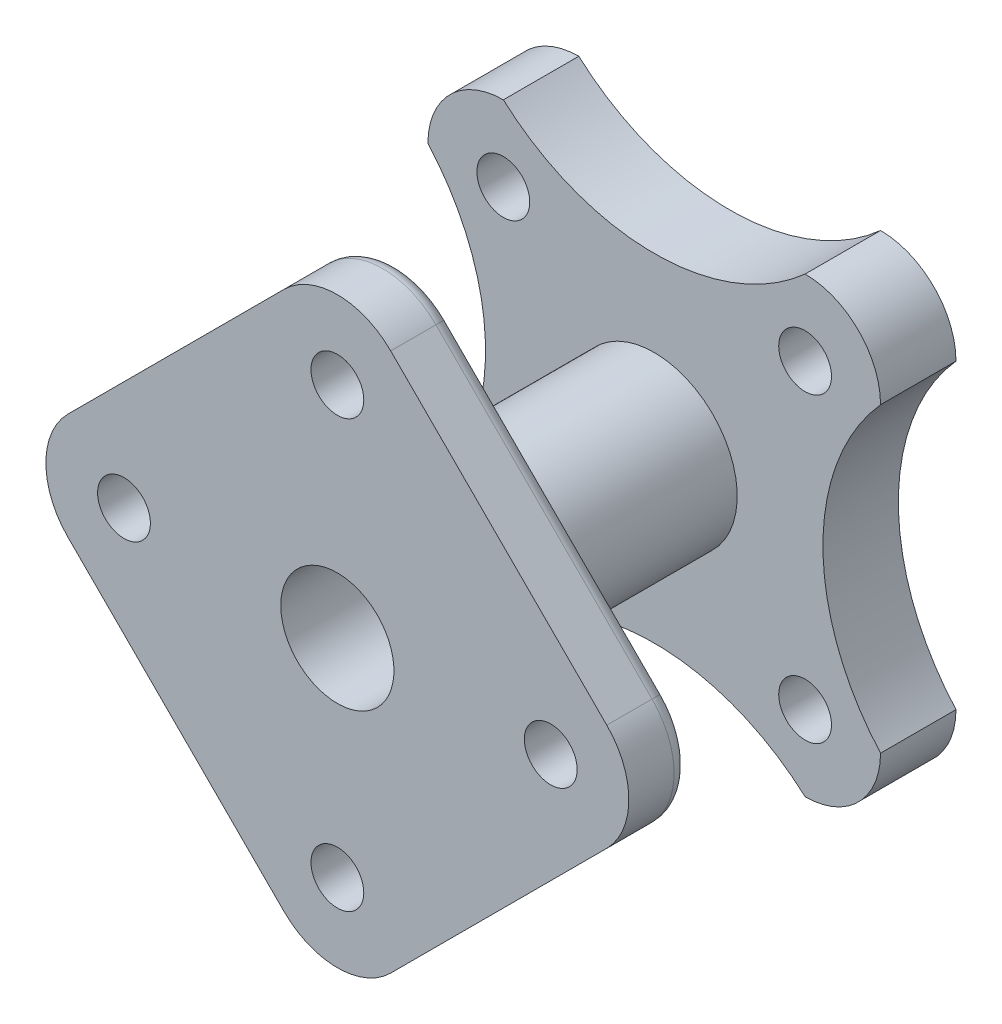
from build123d import *

# Parameters (mm, degrees)
SKETCH1_R           = 4.445
BOSS_EXTRUDE1_DEPTH = 10.16
FILLET1_R           = 12.7
SKETCH2_R           = 13.97
BOSS_EXTRUDE2_DEPTH = 43.18
SKETCH4_R           = 4.445
BOSS_EXTRUDE3_DEPTH = 12.7
SKETCH5_R           = 9.525
CUT_EXTRUDE2_DEPTH  = 109.223551539
SKETCH6_R           = 19.05
CUT_EXTRUDE3_DEPTH  = 2.54
CHAMFER1_SIZE       = 2.54
FILLET2_R           = 2.54


with BuildPart() as part:
    # Sketch1 → Boss-Extrude1 (new body)
    with BuildSketch(Plane.XY):
        Polygon((10.696130127, -43.269340837), (-25.224894357, -7.348316353), (-34.430434771, 1.857224061), (-25.224894357, 11.062764475), (10.696130127, 46.98378896), (19.901670541, 56.189329374), (29.107210955, 46.98378896), (65.02823544, 11.062764475), (74.233775854, 1.857224061), (65.02823544, -7.348316353), (29.107210955, -43.269340837), (19.901670541, -52.474881251), align=None)
        with Locations((-16.019353943, 1.857224061)):
            Circle(SKETCH1_R, mode=Mode.SUBTRACT)
        with Locations((19.901670541, 37.778248545)):
            Circle(SKETCH1_R, mode=Mode.SUBTRACT)
        with Locations((19.901670541, -34.063800423)):
            Circle(SKETCH1_R, mode=Mode.SUBTRACT)
        with Locations((55.822695025, 1.857224061)):
            Circle(SKETCH1_R, mode=Mode.SUBTRACT)
    extrude(amount=BOSS_EXTRUDE1_DEPTH)

    # Fillet1
    fillet1_edges = [part.edges().sort_by_distance(p)[0] for p in [
        (-34.430434771, 1.857224061, 5.08),
        (19.901670541, 56.189329374, 5.08),
        (74.233775854, 1.857224061, 5.08),
        (19.901670541, -52.474881251, 5.08),
    ]]
    fillet(fillet1_edges, radius=FILLET1_R)

    # Sketch2 → Boss-Extrude2 (add)
    with BuildSketch(Plane.XY):
        with Locations((19.901670541, 1.857224061)):
            Circle(SKETCH2_R)
    extrude(amount=-BOSS_EXTRUDE2_DEPTH)

    # Sketch4 → Boss-Extrude3 (add)
    with BuildSketch(Plane(origin=(0, 0, -43.18), x_dir=(-1, 0, 0), z_dir=(0, 0, -1))):
        with BuildLine():
            ThreePointArc((-45.301670541, 39.957224061), (-54.281926662, 36.237480182), (-58.001670541, 27.257224061))
            ThreePointArc((-58.001670541, 27.257224061), (-48.299733855, 1.857224061), (-58.001670541, -23.542775939))
            ThreePointArc((-58.001670541, -23.542775939), (-54.281926662, -32.52303206), (-45.301670541, -36.242775939))
            ThreePointArc((-45.301670541, -36.242775939), (-19.901670541, -26.540839253), (5.498329459, -36.242775939))
            ThreePointArc((5.498329459, -36.242775939), (14.47858558, -32.52303206), (18.198329459, -23.542775939))
            ThreePointArc((18.198329459, -23.542775939), (8.496392773, 1.857224061), (18.198329459, 27.257224061))
            ThreePointArc((18.198329459, 27.257224061), (14.47858558, 36.237480182), (5.498329459, 39.957224061))
            ThreePointArc((5.498329459, 39.957224061), (-19.901670541, 30.255287375), (-45.301670541, 39.957224061))
        make_face()
        with Locations((-45.301670541, 27.257224061)):
            Circle(SKETCH4_R, mode=Mode.SUBTRACT)
        with Locations((5.498329459, 27.257224061)):
            Circle(SKETCH4_R, mode=Mode.SUBTRACT)
        with Locations((5.498329459, -23.542775939)):
            Circle(SKETCH4_R, mode=Mode.SUBTRACT)
        with Locations((-45.301670541, -23.542775939)):
            Circle(SKETCH4_R, mode=Mode.SUBTRACT)
    extrude(amount=BOSS_EXTRUDE3_DEPTH)

    # Sketch5 → Cut-Extrude2 (cut, through all)
    with BuildSketch(Plane(origin=(0, 0, -55.88), x_dir=(-1, 0, 0), z_dir=(0, 0, -1))):
        with Locations((-19.901670541, 0.843392699)):
            Circle(SKETCH5_R)
    extrude(amount=-CUT_EXTRUDE2_DEPTH, mode=Mode.SUBTRACT)

    # Sketch6 → Cut-Extrude3 (cut)
    with BuildSketch(Plane(origin=(0, 0, -55.88), x_dir=(-1, 0, 0), z_dir=(0, 0, -1))):
        with Locations((-19.901670541, 0.843392699)):
            Circle(SKETCH6_R)
    extrude(amount=-CUT_EXTRUDE3_DEPTH, mode=Mode.SUBTRACT)

    # Chamfer1
    chamfer1_edges = [part.edges().sort_by_distance(p)[0] for p in [
        (38.951670541, 0.843392699, -55.88),
    ]]
    chamfer(chamfer1_edges, length=CHAMFER1_SIZE - 0.0001)  # a hair under: the kernel refuses the full size

    # Fillet2
    fillet2_edges = [part.edges().sort_by_distance(p)[0] for p in [
        (47.067723198, -25.308828595, 0),
        (-7.264382115, -25.308828595, 0),
        (-7.264382115, 29.023276718, 0),
        (47.067723198, 29.023276718, 0),
        (19.901670541, 50.928817132, 0),
        (-29.169922529, 1.857224061, 0),
        (68.973263612, 1.857224061, 0),
        (19.901670541, -47.214369009, 0),
    ]]
    fillet(fillet2_edges, radius=FILLET2_R)


solid = part.part
